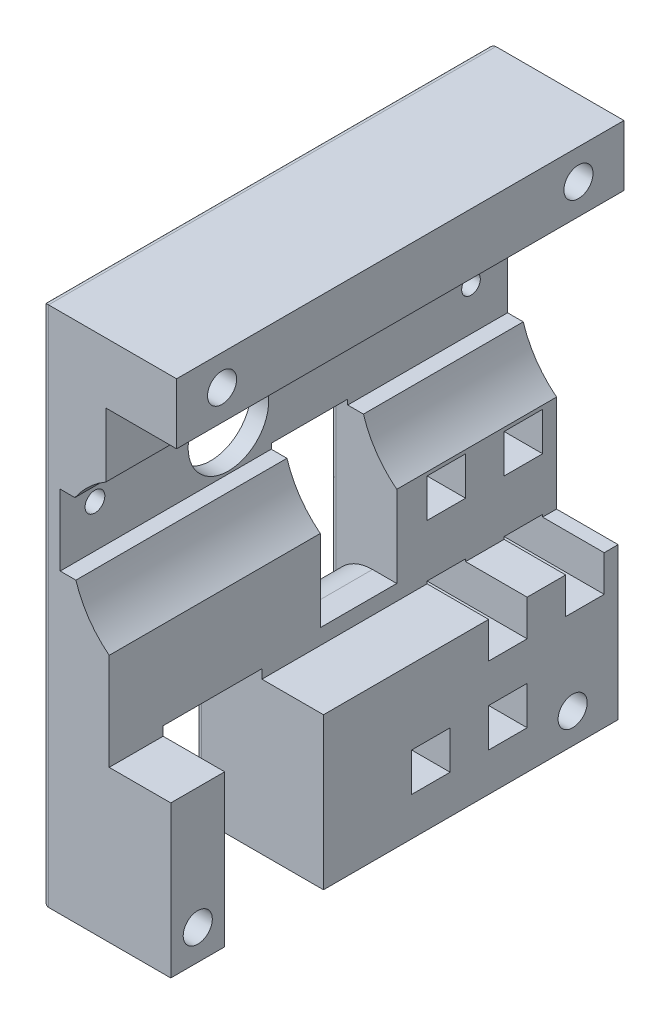
from build123d import *

# Parameters (mm, degrees)
PROFILEEXTRUDE_DEPTH    = 73.76
HOSEWINDOW_W            = 16.29
HOSEWINDOW_H            = 26.5
HOSEWINDOWCUT_DEPTH     = 95.161864378
CAGESCREWS_R            = 2.4
CAGESCREWSCUT_DEPTH     = 95.161864378
AXLEHOLECUT_DEPTH       = 95.161864378
SETSCREWHOLES_R         = 1.539432213
SETSCREWHOLES_R_2       = 1.628953018
SETSCREWHOLESCUT_DEPTH  = 95.161864456
VELOCITYWINDOW_W        = 12.61
VELOCITYWINDOW_H        = 22.29
VELOCITYWINDOWCUT_DEPTH = 95.161864456
FILLET3_R               = 7
TRIGGERRACKSLOTCUT_W    = 6.35
TRIGGERRACKSLOTCUT_H    = 6.35
RACKSLOTCUT_DEPTH       = 95.161864456
FILLET4_R               = 1


with BuildPart() as part:
    # Profile → ProfileExtrude (new body)
    with BuildSketch(Plane.XY):
        with BuildLine():
            Line((9.301269376, -54.194713793), (9.301269376, -29.194713793))
            Line((9.301269376, -29.194713793), (-0.848730624, -29.194713793))
            Line((-0.848730624, -29.194713793), (-0.848730624, -13.196583793))
            ThreePointArc((-0.848730624, -13.196583793), (-4.204324299, -9.619560571), (-6.340730624, -5.204713793))
            Line((-6.340730624, -5.204713793), (-8.928730624, -5.204713793))
            Line((-8.928730624, -5.204713793), (-8.928730624, 6.495286207))
            Line((-8.928730624, 6.495286207), (-6.509650624, 6.495286207))
            ThreePointArc((-6.509650624, 6.495286207), (-4.210311879, 9.168674207), (-1.388730624, 11.283536207))
            Line((-1.388730624, 11.283536207), (-1.388730624, 21.845286207))
            Line((-1.388730624, 21.845286207), (10.261269376, 21.845286207))
            Line((10.261269376, 21.845286207), (10.261269376, 31.845286207))
            Line((10.261269376, 31.845286207), (-11.848730624, 31.845286207))
            Line((-11.848730624, 31.845286207), (-11.848730624, -54.194713793))
            Line((-11.848730624, -54.194713793), (9.301269376, -54.194713793))
        make_face()
    extrude(amount=PROFILEEXTRUDE_DEPTH)

    # HoseWindow → HoseWindowCut (cut, through all)
    with BuildSketch(Plane.ZY.offset(11.848730624)):
        with Locations((56.725, -40.944713793)):
            Rectangle(HOSEWINDOW_W, HOSEWINDOW_H)
    extrude(amount=-HOSEWINDOWCUT_DEPTH, mode=Mode.SUBTRACT)

    # CageScrews → CageScrewsCut (cut, through all)
    with BuildSketch(Plane.ZY.offset(11.848730624)):
        with Locations((7.5, 26.845286207)):
            Circle(CAGESCREWS_R)
        with Locations((66.26, 26.845286207)):
            Circle(CAGESCREWS_R)
        with Locations((7.5, -49.194713793)):
            Circle(CAGESCREWS_R)
        with Locations((69.31, -49.194713793)):
            Circle(CAGESCREWS_R)
    extrude(amount=-CAGESCREWSCUT_DEPTH, mode=Mode.SUBTRACT)

    # AxleHole → AxleHoleCut (cut, through all)
    with BuildSketch(Plane.ZY.offset(11.848730624)):
        with BuildLine():
            Line((47.361, 8.359497151), (47.361, 6.740497151))
            Line((47.361, 6.740497151), (44.699, 6.740497151))
            Line((44.699, 6.740497151), (44.699, 8.359497151))
            ThreePointArc((44.699, 8.359497151), (46.03, -4.783713793), (47.361, 8.359497151))
        make_face()
    extrude(amount=-AXLEHOLECUT_DEPTH, mode=Mode.SUBTRACT)

    # SetScrewHoles → SetScrewHolesCut (cut, through all)
    with BuildSketch(Plane.ZY.offset(11.848730624)):
        with Locations((6.03, 1.855286207)):
            Circle(SETSCREWHOLES_R)
        with Locations((68.03, 1.855286207)):
            Circle(SETSCREWHOLES_R_2)
    extrude(amount=-SETSCREWHOLESCUT_DEPTH, mode=Mode.SUBTRACT)

    # VelocityWindow → VelocityWindowCut (cut, through all)
    with BuildSketch(Plane.ZY.offset(11.848730624)):
        with Locations((32.655, -15.499713793)):
            Rectangle(VELOCITYWINDOW_W, VELOCITYWINDOW_H)
    extrude(amount=-VELOCITYWINDOWCUT_DEPTH, mode=Mode.SUBTRACT)

    # Fillet3
    fillet3_edges = [part.edges().sort_by_distance(p)[0] for p in [
        (-11.848730624, -26.644713793, 32.655),
    ]]
    fillet(fillet3_edges, radius=FILLET3_R)

    # TriggerRackSlotCut → RackSlotCut (cut, through all)
    with BuildSketch(Plane.ZY.offset(11.848730624)):
        with Locations((18.175, -44.669713793)):
            Rectangle(TRIGGERRACKSLOTCUT_W, TRIGGERRACKSLOTCUT_H)
        with Locations((30.875, -44.669713793)):
            Rectangle(TRIGGERRACKSLOTCUT_W, TRIGGERRACKSLOTCUT_H)
        with Locations((5.475, -31.969713793)):
            Rectangle(TRIGGERRACKSLOTCUT_W, TRIGGERRACKSLOTCUT_H)
        with Locations((18.175, -31.969713793)):
            Rectangle(TRIGGERRACKSLOTCUT_W, TRIGGERRACKSLOTCUT_H)
        with Locations((5.475, -16.969713793)):
            Rectangle(TRIGGERRACKSLOTCUT_W, TRIGGERRACKSLOTCUT_H)
        with Locations((18.175, -16.969713793)):
            Rectangle(TRIGGERRACKSLOTCUT_W, TRIGGERRACKSLOTCUT_H)
    extrude(amount=-RACKSLOTCUT_DEPTH, mode=Mode.SUBTRACT)

    # Fillet4
    fillet4_edges = [part.edges().sort_by_distance(p)[0] for p in [
        (-11.848730624, -16.969713793, 15),
        (-11.848730624, -20.144713793, 18.175),
        (-11.848730624, -16.969713793, 21.35),
        (-11.848730624, -13.794713793, 18.175),
        (-11.848730624, -13.794713793, 5.475),
        (-11.848730624, -16.969713793, 2.3),
        (-11.848730624, -16.969713793, 8.65),
        (-11.848730624, -20.144713793, 5.475),
        (-11.848730624, -35.144713793, 5.475),
        (-11.848730624, -31.969713793, 2.3),
        (-11.848730624, -28.794713793, 5.475),
        (-11.848730624, -31.969713793, 8.65),
        (-11.848730624, -31.969713793, 21.35),
        (-11.848730624, -28.794713793, 18.175),
        (-11.848730624, -31.969713793, 15),
        (-11.848730624, -35.144713793, 18.175),
        (-11.848730624, -47.844713793, 18.175),
        (-11.848730624, -44.669713793, 15),
        (-11.848730624, -41.494713793, 18.175),
        (-11.848730624, -44.669713793, 21.35),
        (-11.848730624, -44.669713793, 27.7),
        (-11.848730624, -47.844713793, 30.875),
        (-11.848730624, -44.669713793, 34.05),
        (-11.848730624, -41.494713793, 30.875),
        (-11.848730624, -18.999713793, 38.96),
        (-11.848730624, -4.354713793, 32.655),
        (-11.848730624, -18.999713793, 26.35),
        (-11.848730624, -11.174713793, 0),
        (-11.848730624, -54.194713793, 24.29),
        (-11.848730624, -40.944713793, 48.58),
        (-11.848730624, -27.694713793, 56.725),
        (-11.848730624, -40.944713793, 64.87),
        (-11.848730624, -54.194713793, 69.315),
        (-11.848730624, -11.174713793, 73.76),
        (-11.848730624, 31.845286207, 36.88),
    ]]
    fillet(fillet4_edges, radius=FILLET4_R)


solid = part.part
